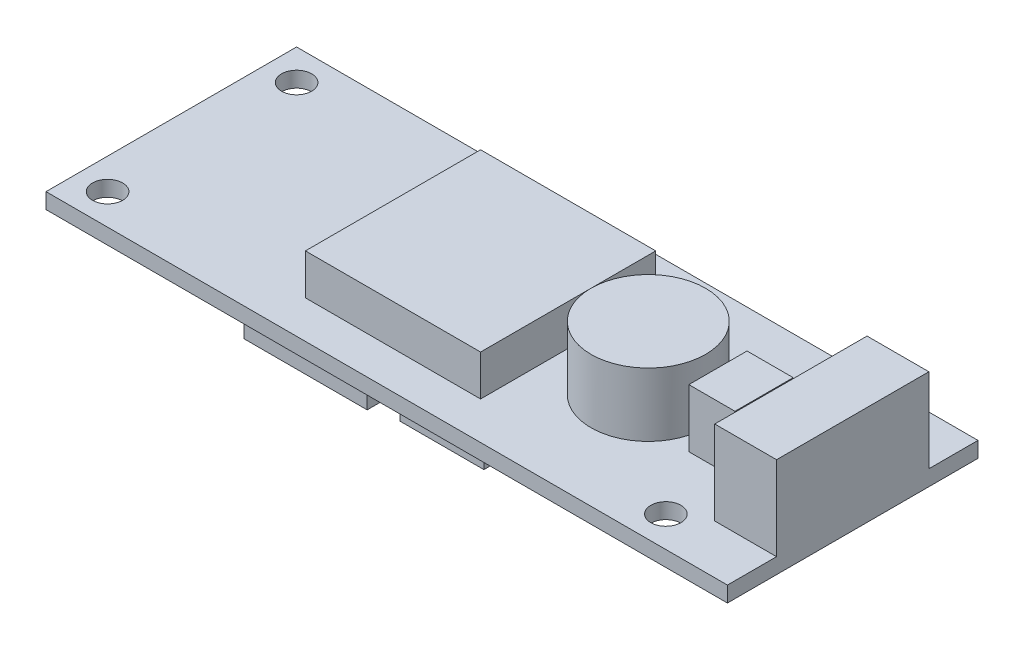
from build123d import *

# Parameters (mm, degrees)
SKETCH1_W                  = 70.00494
SKETCH1_H                  = 25.7429
SKETCH1_R                  = 1.5494
PCB_DEPTH                  = 1.6002
TOP_FEATURES_W             = 17.9959
TOP_FEATURES_H             = 17.9959
GPS_ANTENNA_DEPTH          = 4.18
SKETCH2_3_W                = 4.74
SKETCH2_3_H                = 5.9817
JST_CONNECTOR_DEPTH        = 5.97
SKETCH2_4_W                = 6.35254
SKETCH2_4_H                = 15.64894
TERMINAL_BLOCK_DEPTH       = 8.63
BOTTOM_FEATURES_W          = 5.0038
BOTTOM_FEATURES_H          = 5.0038
CC1200_DEPTH               = 1.13
BOTTOM_FEATURES_4_W        = 12.6746
BOTTOM_FEATURES_4_H        = 10.5918
UBLOX_DEPTH                = 2.48
BOTTOM_FEATURES_5_W        = 8.636
BOTTOM_FEATURES_5_H        = 5.2705
FLASH_DEPTH                = 1.48
BOTTOM_FEATURES_6_W        = 5.04
BOTTOM_FEATURES_6_H        = 3.02
BARO_DEPTH                 = 1.22
BOTTOM_FEATURES_7_W        = 6.9723
BOTTOM_FEATURES_7_H        = 6.9723
UC_DEPTH                   = 0.87
BOTTOM_FEATURES_8_W        = 8.0391
BOTTOM_FEATURES_8_H        = 5.8293
USB_DEPTH                  = 2.57
BOTTOM_FEATURES_9_W        = 5.02666
BOTTOM_FEATURES_9_H        = 2.9972
ACCELEROMETER_DEPTH        = 1.12
TERMINALBLOCK_SOLDER_DEPTH = 2.17
TOP_FEATURES_5_R           = 5.885
BOSS_EXTRUDE13_DEPTH       = 6.53


with BuildPart() as part:
    # Sketch1 → PCB (new body)
    with BuildSketch(Plane(origin=(0, 0, 0), x_dir=(1, 0, 0), z_dir=(0, 1, 0))):
        Rectangle(SKETCH1_W, SKETCH1_H)
        with Locations((-31.84017, 9.70915)):
            Circle(SKETCH1_R, mode=Mode.SUBTRACT)
        with Locations((-31.84017, -9.70915)):
            Circle(SKETCH1_R, mode=Mode.SUBTRACT)
        with Locations((25.51557, 9.70915)):
            Circle(SKETCH1_R, mode=Mode.SUBTRACT)
        with Locations((25.51557, -9.70915)):
            Circle(SKETCH1_R, mode=Mode.SUBTRACT)
    extrude(amount=PCB_DEPTH)

    # top_features → gps_antenna (add)
    with BuildSketch(Plane(origin=(0, 1.6002, 0), x_dir=(1, 0, 0), z_dir=(0, 1, 0))):
        with Locations((-3.22834, 0)):
            Rectangle(TOP_FEATURES_W, TOP_FEATURES_H)
    extrude(amount=GPS_ANTENNA_DEPTH)

    # Sketch2<3> → jst_connector (add)
    with BuildSketch(Plane(origin=(0, 1.6002, 0), x_dir=(1, 0, 0), z_dir=(0, 1, 0))):
        with Locations((23.52693, 0)):
            Rectangle(SKETCH2_3_W, SKETCH2_3_H)
    extrude(amount=JST_CONNECTOR_DEPTH)

    # Sketch2<4> → terminal_block (add)
    with BuildSketch(Plane(origin=(0, 1.6002, 0), x_dir=(1, 0, 0), z_dir=(0, 1, 0))):
        with Locations((31.8262, 0)):
            Rectangle(SKETCH2_4_W, SKETCH2_4_H)
    extrude(amount=TERMINAL_BLOCK_DEPTH)

    # bottom_features → cc1200 (add)
    with BuildSketch(Plane.XZ):
        with Locations((-18.70057, -2.18955)):
            Rectangle(BOTTOM_FEATURES_W, BOTTOM_FEATURES_H)
    extrude(amount=CC1200_DEPTH)

    # bottom_features<4> → ublox (add)
    with BuildSketch(Plane.XZ):
        with Locations((-9.50517, 6.41555)):
            Rectangle(BOTTOM_FEATURES_4_W, BOTTOM_FEATURES_4_H)
    extrude(amount=UBLOX_DEPTH)

    # bottom_features<5> → flash (add)
    with BuildSketch(Plane.XZ):
        with Locations((4.82447, 9.3962)):
            Rectangle(BOTTOM_FEATURES_5_W, BOTTOM_FEATURES_5_H)
    extrude(amount=FLASH_DEPTH)

    # bottom_features<6> → baro (add)
    with BuildSketch(Plane.XZ):
        with Locations((13.77247, 8.02145)):
            Rectangle(BOTTOM_FEATURES_6_W, BOTTOM_FEATURES_6_H)
    extrude(amount=BARO_DEPTH)

    # bottom_features<7> → uC (add)
    with BuildSketch(Plane.XZ):
        with Locations((5.75632, -0.7353)):
            Rectangle(BOTTOM_FEATURES_7_W, BOTTOM_FEATURES_7_H)
    extrude(amount=UC_DEPTH)

    # bottom_features<8> → usb (add)
    with BuildSketch(Plane.XZ):
        with Locations((15.47292, -9.9568)):
            Rectangle(BOTTOM_FEATURES_8_W, BOTTOM_FEATURES_8_H)
    extrude(amount=USB_DEPTH)

    # bottom_features<9> → accelerometer (add)
    with BuildSketch(Plane.XZ):
        with Locations((-11.5358, -7.42285)):
            Rectangle(BOTTOM_FEATURES_9_W, BOTTOM_FEATURES_9_H)
    extrude(amount=ACCELEROMETER_DEPTH)

    # bottom_features<10> → terminalblock_solder (add)
    with BuildSketch(Plane.XZ):
        with BuildLine():
            Line((32.25247, 6.4), (32.25247, -6.4))
            ThreePointArc((32.25247, -6.4), (31.39247, -7.26), (30.53247, -6.4))
            Line((30.53247, -6.4), (30.53247, 6.4))
            ThreePointArc((30.53247, 6.4), (31.39247, 7.26), (32.25247, 6.4))
        make_face()
    extrude(amount=TERMINALBLOCK_SOLDER_DEPTH)

    # top_features<5> → Boss-Extrude13 (add)
    with BuildSketch(Plane(origin=(0, 1.6002, 0), x_dir=(1, 0, 0), z_dir=(0, 1, 0))):
        with Locations((14.00253, 0)):
            Circle(TOP_FEATURES_5_R)
    extrude(amount=BOSS_EXTRUDE13_DEPTH)


solid = part.part
